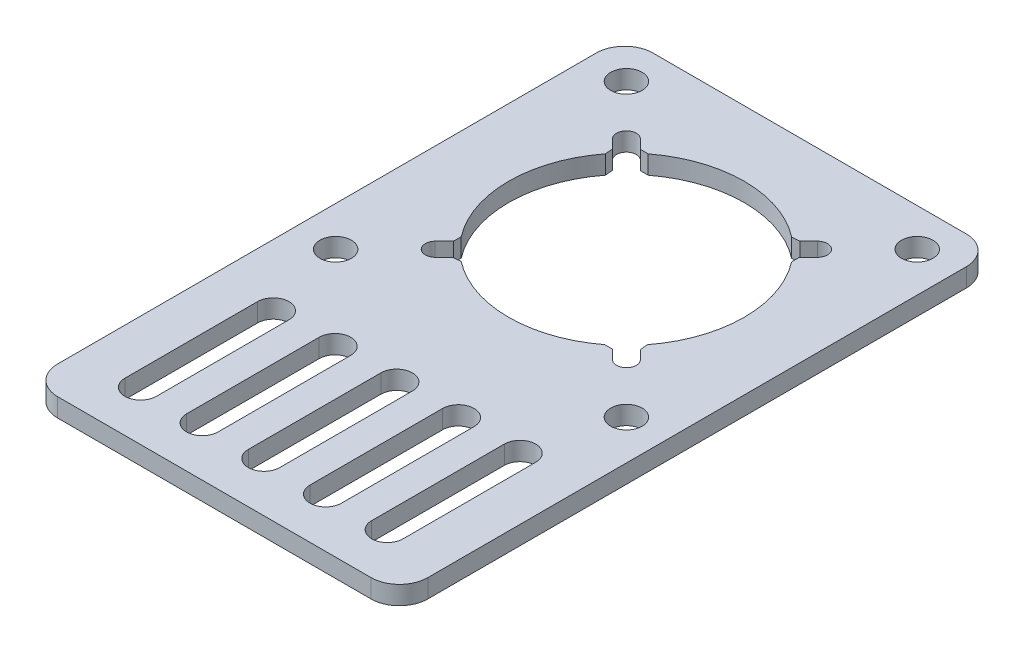
from build123d import *

# Parameters (mm, degrees)
SKETCH1_R           = 2.55
BOSS_EXTRUDE1_DEPTH = 3
CHAMFER1_SIZE       = 0.876505316
CHAMFER1_SIZE_2     = 0.8


with BuildPart() as part:
    # Sketch1 → Boss-Extrude1 (new body)
    with BuildSketch(Plane(origin=(0, 0, 0), x_dir=(1, 0, 0), z_dir=(0, 1, 0))):
        with BuildLine():
            Line((25.4, -66.8), (-25.4, -66.8))
            ThreePointArc((-25.4, -66.8), (-28.652691193, -65.452691193), (-30, -62.2))
            Line((-30, -62.2), (-30, 25.1))
            ThreePointArc((-30, 25.1), (-28.652691193, 28.352691193), (-25.4, 29.7))
            Line((-25.4, 29.7), (25.4, 29.7))
            ThreePointArc((25.4, 29.7), (28.652691193, 28.352691193), (30, 25.1))
            Line((30, 25.1), (30, -62.2))
            ThreePointArc((30, -62.2), (28.652691193, -65.452691193), (25.4, -66.8))
        make_face()
        with Locations(Location((-23.57, 23.57, 0), (0, 0, 270))):
            Circle(SKETCH1_R, mode=Mode.SUBTRACT)
        with Locations(Location((23.57, 23.57, 0), (0, 0, 90))):
            Circle(SKETCH1_R, mode=Mode.SUBTRACT)
        with Locations(Location((23.57, -23.57, 0), (0, 0, 270))):
            Circle(SKETCH1_R, mode=Mode.SUBTRACT)
        with Locations(Location((-23.57, -23.57, 0), (0, 0, 90))):
            Circle(SKETCH1_R, mode=Mode.SUBTRACT)
        with BuildLine():
            Line((17.45, -58.75), (17.45, -37.25))
            ThreePointArc((17.45, -37.25), (20, -34.7), (22.55, -37.25))
            Line((22.55, -37.25), (22.55, -58.75))
            ThreePointArc((22.55, -58.75), (20, -61.3), (17.45, -58.75))
        make_face(mode=Mode.SUBTRACT)
        with BuildLine():
            Line((7.45, -58.75), (7.45, -37.25))
            ThreePointArc((7.45, -37.25), (10, -34.7), (12.55, -37.25))
            Line((12.55, -37.25), (12.55, -58.75))
            ThreePointArc((12.55, -58.75), (10, -61.3), (7.45, -58.75))
        make_face(mode=Mode.SUBTRACT)
        with BuildLine():
            Line((-2.55, -58.75), (-2.55, -37.25))
            ThreePointArc((-2.55, -37.25), (0, -34.7), (2.55, -37.25))
            Line((2.55, -37.25), (2.55, -58.75))
            ThreePointArc((2.55, -58.75), (0, -61.3), (-2.55, -58.75))
        make_face(mode=Mode.SUBTRACT)
        with BuildLine():
            Line((-12.55, -58.75), (-12.55, -37.25))
            ThreePointArc((-12.55, -37.25), (-10, -34.7), (-7.45, -37.25))
            Line((-7.45, -37.25), (-7.45, -58.75))
            ThreePointArc((-7.45, -58.75), (-10, -61.3), (-12.55, -58.75))
        make_face(mode=Mode.SUBTRACT)
        with BuildLine():
            Line((-22.55, -58.75), (-22.55, -37.25))
            ThreePointArc((-22.55, -37.25), (-20, -34.7), (-17.45, -37.25))
            Line((-17.45, -37.25), (-17.45, -58.75))
            ThreePointArc((-17.45, -58.75), (-20, -61.3), (-22.55, -58.75))
        make_face(mode=Mode.SUBTRACT)
        with BuildLine():
            Line((14.36862915, 16.63137085), (12.326897984, 14.589639684))
            ThreePointArc((12.326897984, 14.589639684), (0, 19.1), (-12.326897984, 14.589639684))
            Line((-12.326897984, 14.589639684), (-14.36862915, 16.63137085))
            ThreePointArc((-14.36862915, 16.63137085), (-16.63137085, 16.63137085), (-16.63137085, 14.36862915))
            Line((-16.63137085, 14.36862915), (-14.589639684, 12.326897984))
            ThreePointArc((-14.589639684, 12.326897984), (-19.1, 0), (-14.589639684, -12.326897984))
            Line((-14.589639684, -12.326897984), (-16.63137085, -14.36862915))
            ThreePointArc((-16.63137085, -14.36862915), (-16.63137085, -16.63137085), (-14.36862915, -16.63137085))
            Line((-14.36862915, -16.63137085), (-12.326897984, -14.589639684))
            ThreePointArc((-12.326897984, -14.589639684), (0, -19.1), (12.326897984, -14.589639684))
            Line((12.326897984, -14.589639684), (14.36862915, -16.63137085))
            ThreePointArc((14.36862915, -16.63137085), (16.63137085, -16.63137085), (16.63137085, -14.36862915))
            Line((16.63137085, -14.36862915), (14.589639684, -12.326897984))
            ThreePointArc((14.589639684, -12.326897984), (19.1, 0), (14.589639684, 12.326897984))
            Line((14.589639684, 12.326897984), (16.63137085, 14.36862915))
            ThreePointArc((16.63137085, 14.36862915), (16.63137085, 16.63137085), (14.36862915, 16.63137085))
        make_face(mode=Mode.SUBTRACT)
    extrude(amount=BOSS_EXTRUDE1_DEPTH)

    # Chamfer1
    # the kernel refuses this chamfer: 0.876505316, 0.8 mm, written as the material it takes off along each edge
    with BuildSketch(Plane(origin=(-14.589639684, -2.258924043, -12.326897984), x_dir=(-0.7071067811865476, 0, -0.7071067811865476), z_dir=(0, 1, 0)), Plane(origin=(-12.326897984, -2.258924043, 14.589639684), x_dir=(-0.7071067811865435, 0, 0.7071067811865516), z_dir=(0, 1, 0)), Plane(origin=(14.589639684, -2.258924043, 12.326897984), x_dir=(0.7071067811865475, 0, 0.7071067811865475), z_dir=(0, 1, 0)), Plane(origin=(12.326897984, -2.258924043, -14.589639684), x_dir=(0.7071067811865465, 0, -0.7071067811865486), z_dir=(0, 1, 0))) as chamfer1_piece_1:
        with BuildLine():
            Line((CHAMFER1_SIZE, 0), (-0.085923492, 0.81316345))
            ThreePointArc((-0.085923492, 0.81316345), (-0.039945159, 0.419640102), (0, 0))
            Line((0, 0), (CHAMFER1_SIZE, 0))
        make_face()
    extrude(amount=7.517848085, mode=Mode.SUBTRACT)
    with BuildSketch(Plane(origin=(-14.589639684, -2.323826689, 12.326897984), x_dir=(-0.6271715557767805, 0, -0.7788811460194248), z_dir=(0, 1, 0)), Plane(origin=(12.326897984, -2.323826689, 14.589639684), x_dir=(-0.7788811460194289, 0, 0.6271715557767755), z_dir=(0, 1, 0)), Plane(origin=(14.589639684, -2.323826689, -12.326897984), x_dir=(0.6271715557767805, 0, 0.7788811460194248), z_dir=(0, 1, 0)), Plane(origin=(-12.326897984, -2.323826689, -14.589639684), x_dir=(0.7788811460194278, 0, -0.6271715557767769), z_dir=(0, 1, 0))) as chamfer1_piece_2:
        with BuildLine():
            Line((0.90196282, 0), (-CHAMFER1_SIZE_2 * 0.107274880032, CHAMFER1_SIZE_2 * 0.994229400146))
            Line((-CHAMFER1_SIZE_2 * 0.107274880032, CHAMFER1_SIZE_2 * 0.994229400146), (0, 0))
            ThreePointArc((0, 0), (0.464646952, 0.005320048), (0.90196282, 0))
        make_face()
    extrude(amount=7.647653377, mode=Mode.SUBTRACT)


solid = part.part
